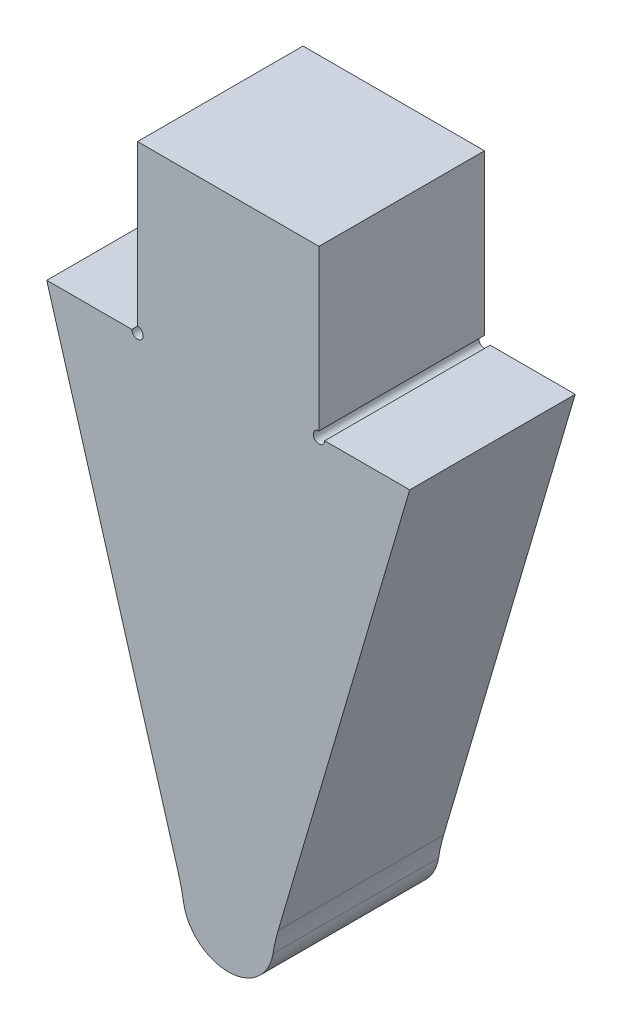
from build123d import *

# Parameters (mm, degrees)
BOSS_EXTRUDE1_DEPTH = 5.7912
FILLET1_R           = 6.35
SKETCH2_R           = 0.1984375
CUT_EXTRUDE1_DEPTH  = 21.985519351


with BuildPart() as part:
    # Sketch1 → Boss-Extrude1 (new body)
    with BuildSketch(Plane.XY):
        with BuildLine():
            Line((-6.35, 0), (-9.525, 0))
            Line((-9.525, 0), (-4.7625, -16.1925))
            ThreePointArc((-4.7625, -16.1925), (-3.175, -17.78), (-1.5875, -16.1925))
            Line((-1.5875, -16.1925), (3.175, 0))
            Line((3.175, 0), (0, 0))
            Line((0, 0), (0, 5.7912))
            Line((0, 5.7912), (-6.35, 5.7912))
            Line((-6.35, 5.7912), (-6.35, 0))
        make_face()
    extrude(amount=BOSS_EXTRUDE1_DEPTH)

    # Fillet1
    fillet1_edges = [part.edges().sort_by_distance(p)[0] for p in [
        (-4.7625, -16.1925, 2.8956),
        (-1.5875, -16.1925, 2.8956),
    ]]
    fillet(fillet1_edges, radius=FILLET1_R)

    # Sketch2 → Cut-Extrude1 (cut, through all)
    with BuildSketch(Plane.XY.offset(5.7912)):
        with Locations((-6.35, 0)):
            Circle(SKETCH2_R)
        Circle(SKETCH2_R)
    extrude(amount=-CUT_EXTRUDE1_DEPTH, mode=Mode.SUBTRACT)


solid = part.part
